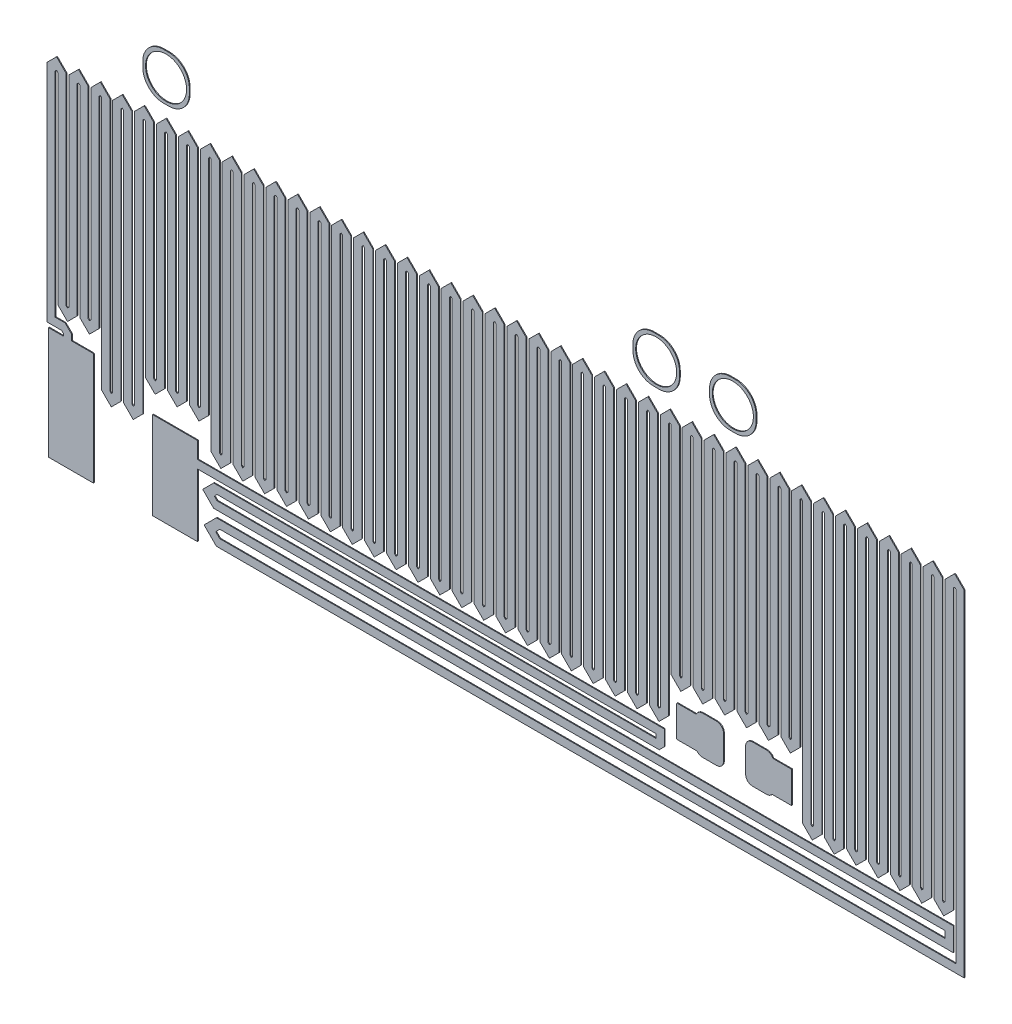
from build123d import *

# Parameters (mm, degrees)
BOSS_EXTRUDE1_DEPTH     = 0.03
BOSS_EXTRUDE1_2_DEPTH   = 0.03
SKETCH4_W               = 1.7
SKETCH4_H               = 1.7
BOSS_EXTRUDE1_3_DEPTH   = 0.03
BOSS_EXTRUDE1_4_DEPTH   = 0.03
BOSS_EXTRUDE1_5_DEPTH   = 0.03
BOSS_EXTRUDE1_6_DEPTH   = 0.03
FILLET1_R               = 0.75
FILLET2_R               = 0.75
FILLET3_R               = 0.75
CUT_EXTRUDE1_DEPTH      = 211.582487992
CUT_EXTRUDE1_DEPTH_BACK = 211.582487992
SKETCH5_R               = 0.75


with BuildPart() as part:
    # Sketch4 → Boss-Extrude1 (new body)
    with BuildSketch(Plane.XY):
        Polygon((165.211, 105.984), (165.158716049, 105.907), (164.464, 105.907), (164.454, 105.903), (164.45, 105.893), (164.45, 104.771), (164.454, 104.761), (164.464, 104.757), (165.192666667, 104.757), (165.211, 104.73), (165.292, 104.676), (165.387, 104.657), (165.912, 104.657), (166.008, 104.676), (166.089, 104.73), (166.143, 104.811), (166.162, 104.907), (166.162, 105.807), (166.143, 105.903), (166.089, 105.984), (166.008, 106.038), (165.912, 106.057), (165.387, 106.057), (165.292, 106.038), align=None)
    extrude(amount=BOSS_EXTRUDE1_DEPTH)


with BuildPart() as body_2:
    # Sketch4 → Boss-Extrude1 2 (new body)
    with BuildSketch(Plane.XY):
        Polygon((166.982, 105.903), (166.963, 105.807), (166.963, 104.907), (166.982, 104.811), (167.036, 104.73), (167.117, 104.676), (167.213, 104.657), (167.738, 104.657), (167.833, 104.676), (167.914, 104.73), (167.932333333, 104.757), (168.636, 104.757), (168.646, 104.761), (168.65, 104.771), (168.65, 105.893), (168.646, 105.903), (168.636, 105.907), (167.966283951, 105.907), (167.914, 105.984), (167.833, 106.038), (167.738, 106.057), (167.213, 106.057), (167.117, 106.038), (167.036, 105.984), align=None)
    extrude(amount=BOSS_EXTRUDE1_2_DEPTH)


with BuildPart() as body_3:
    # Sketch4 → Boss-Extrude1 3 (new body)
    with BuildSketch(Plane.XY):
        with Locations((145.8, 116.357)):
            Rectangle(SKETCH4_W, SKETCH4_H)
    extrude(amount=BOSS_EXTRUDE1_3_DEPTH)

    # Fillet1
    fillet1_edges = [body_3.edges().sort_by_distance(p)[0] for p in [
        (146.65, 115.507, 0.015),
        (144.95, 115.507, 0.015),
        (144.95, 117.207, 0.015),
        (146.65, 117.207, 0.015),
    ]]
    fillet(fillet1_edges, radius=FILLET1_R)


with BuildPart() as body_4:
    # Sketch4 → Boss-Extrude1 4 (new body)
    with BuildSketch(Plane.XY):
        with Locations((163.7, 116.357)):
            Rectangle(SKETCH4_W, SKETCH4_H)
    extrude(amount=BOSS_EXTRUDE1_4_DEPTH)

    # Fillet2
    fillet2_edges = [body_4.edges().sort_by_distance(p)[0] for p in [
        (164.55, 115.507, 0.015),
        (162.85, 115.507, 0.015),
        (164.55, 117.207, 0.015),
        (162.85, 117.207, 0.015),
    ]]
    fillet(fillet2_edges, radius=FILLET2_R)


with BuildPart() as body_5:
    # Sketch4 → Boss-Extrude1 5 (new body)
    with BuildSketch(Plane.XY):
        with Locations((166.5, 116.357)):
            Rectangle(SKETCH4_W, SKETCH4_H)
    extrude(amount=BOSS_EXTRUDE1_5_DEPTH)

    # Fillet3
    fillet3_edges = [body_5.edges().sort_by_distance(p)[0] for p in [
        (165.65, 117.207, 0.015),
        (165.65, 115.507, 0.015),
        (167.35, 115.507, 0.015),
        (167.35, 117.207, 0.015),
    ]]
    fillet(fillet3_edges, radius=FILLET3_R)


with BuildPart() as body_6:
    # Sketch4 → Boss-Extrude1 6 (new body)
    with BuildSketch(Plane.XY):
        Polygon((143.136, 106.307), (142.35, 106.307), (142.35, 106.519132034), (142.112132034, 106.757), (141.75, 106.757), (141.75, 114.544867966), (141.8, 114.594867966), (141.85, 114.544867966), (141.85, 107.194867966), (142.2, 106.844867966), (142.55, 107.194867966), (142.55, 114.544867966), (142.6, 114.594867966), (142.65, 114.544867966), (142.65, 107.194867966), (143, 106.844867966), (143.35, 107.194867966), (143.35, 114.544867966), (143.4, 114.594867966), (143.45, 114.544867966), (143.45, 105.294867966), (143.8, 104.944867966), (144.15, 105.294867966), (144.15, 114.544867966), (144.2, 114.594867966), (144.25, 114.544867966), (144.25, 105.294867966), (144.6, 104.944867966), (144.95, 105.294867966), (144.95, 114.594867966), (145, 114.644867966), (145.05, 114.594867966), (145.05, 106.494867966), (145.4, 106.144867966), (145.75, 106.494867966), (145.75, 114.594867966), (145.8, 114.644867966), (145.85, 114.594867966), (145.85, 106.494867966), (146.2, 106.144867966), (146.55, 106.494867966), (146.55, 114.594867966), (146.6, 114.644867966), (146.65, 114.594867966), (146.65, 106.444867966), (147, 106.094867966), (147.35, 106.444867966), (147.35, 114.594867966), (147.4, 114.644867966), (147.45, 114.594867966), (147.45, 105.344867966), (147.8, 104.994867966), (148.15, 105.344867966), (148.15, 114.594867966), (148.2, 114.644867966), (148.25, 114.594867966), (148.25, 105.344867966), (148.6, 104.994867966), (148.95, 105.344867966), (148.95, 114.594867966), (149, 114.644867966), (149.05, 114.594867966), (149.05, 105.344867966), (149.4, 104.994867966), (149.75, 105.344867966), (149.75, 114.594867966), (149.8, 114.644867966), (149.85, 114.594867966), (149.85, 105.344867966), (150.2, 104.994867966), (150.55, 105.344867966), (150.55, 114.594867966), (150.6, 114.644867966), (150.65, 114.594867966), (150.65, 105.344867966), (151, 104.994867966), (151.35, 105.344867966), (151.35, 114.594867966), (151.4, 114.644867966), (151.45, 114.594867966), (151.45, 105.344867966), (151.8, 104.994867966), (152.15, 105.344867966), (152.15, 114.594867966), (152.2, 114.644867966), (152.25, 114.594867966), (152.25, 105.344867966), (152.6, 104.994867966), (152.95, 105.344867966), (152.95, 114.594867966), (153, 114.644867966), (153.05, 114.594867966), (153.05, 105.344867966), (153.4, 104.994867966), (153.75, 105.344867966), (153.75, 114.594867966), (153.8, 114.644867966), (153.85, 114.594867966), (153.85, 105.344867966), (154.2, 104.994867966), (154.55, 105.344867966), (154.55, 114.594867966), (154.6, 114.644867966), (154.65, 114.594867966), (154.65, 105.344867966), (155, 104.994867966), (155.35, 105.344867966), (155.35, 114.594867966), (155.4, 114.644867966), (155.45, 114.594867966), (155.45, 105.344867966), (155.8, 104.994867966), (156.15, 105.344867966), (156.15, 114.594867966), (156.2, 114.644867966), (156.25, 114.594867966), (156.25, 105.344867966), (156.6, 104.994867966), (156.95, 105.344867966), (156.95, 114.594867966), (157, 114.644867966), (157.05, 114.594867966), (157.05, 105.344867966), (157.4, 104.994867966), (157.75, 105.344867966), (157.75, 114.594867966), (157.8, 114.644867966), (157.85, 114.594867966), (157.85, 105.344867966), (158.2, 104.994867966), (158.55, 105.344867966), (158.55, 114.594867966), (158.6, 114.644867966), (158.65, 114.594867966), (158.65, 105.344867966), (159, 104.994867966), (159.35, 105.344867966), (159.35, 114.594867966), (159.4, 114.644867966), (159.45, 114.594867966), (159.45, 105.344867966), (159.8, 104.994867966), (160.15, 105.344867966), (160.15, 114.594867966), (160.2, 114.644867966), (160.25, 114.594867966), (160.25, 105.344867966), (160.6, 104.994867966), (160.95, 105.344867966), (160.95, 114.594867966), (161, 114.644867966), (161.05, 114.594867966), (161.05, 105.344867966), (161.4, 104.994867966), (161.75, 105.344867966), (161.75, 114.594867966), (161.8, 114.644867966), (161.85, 114.594867966), (161.85, 105.344867966), (162.2, 104.994867966), (162.55, 105.344867966), (162.55, 114.594867966), (162.6, 114.644867966), (162.65, 114.594867966), (162.65, 105.344867966), (163, 104.994867966), (163.35, 105.344867966), (163.35, 114.594867966), (163.4, 114.644867966), (163.45, 114.594867966), (163.45, 105.344867966), (163.8, 104.994867966), (164.15, 105.344867966), (164.15, 114.594867966), (164.2, 114.644867966), (164.25, 114.594867966), (164.25, 106.694867966), (164.6, 106.344867966), (164.95, 106.694867966), (164.95, 114.594867966), (165, 114.644867966), (165.05, 114.594867966), (165.05, 106.694867966), (165.4, 106.344867966), (165.75, 106.694867966), (165.75, 114.594867966), (165.8, 114.644867966), (165.85, 114.594867966), (165.85, 106.744867966), (166.2, 106.394867966), (166.55, 106.744867966), (166.55, 114.594867966), (166.6, 114.644867966), (166.65, 114.594867966), (166.65, 106.744867966), (167, 106.394867966), (167.35, 106.744867966), (167.35, 114.594867966), (167.4, 114.644867966), (167.45, 114.594867966), (167.45, 106.744867966), (167.8, 106.394867966), (168.15, 106.744867966), (168.15, 114.594867966), (168.2, 114.644867966), (168.25, 114.594867966), (168.25, 106.744867966), (168.6, 106.394867966), (168.95, 106.744867966), (168.95, 114.594867966), (169, 114.644867966), (169.05, 114.594867966), (169.05, 104.394867966), (169.4, 104.044867966), (169.75, 104.394867966), (169.75, 114.594867966), (169.8, 114.644867966), (169.85, 114.594867966), (169.85, 104.344867966), (170.2, 103.994867966), (170.55, 104.344867966), (170.55, 114.594867966), (170.6, 114.644867966), (170.65, 114.594867966), (170.65, 104.394867966), (171, 104.044867966), (171.35, 104.394867966), (171.35, 114.594867966), (171.4, 114.644867966), (171.45, 114.594867966), (171.45, 104.394867966), (171.8, 104.044867966), (172.15, 104.394867966), (172.15, 114.594867966), (172.2, 114.644867966), (172.25, 114.594867966), (172.25, 104.394867966), (172.6, 104.044867966), (172.95, 104.394867966), (172.95, 114.594867966), (173, 114.644867966), (173.05, 114.594867966), (173.05, 104.394867966), (173.4, 104.044867966), (173.75, 104.394867966), (173.75, 114.594867966), (173.8, 114.644867966), (173.85, 114.594867966), (173.85, 104.394867966), (174.2, 104.044867966), (174.55, 104.394867966), (174.55, 114.594867966), (174.6, 114.644867966), (174.65, 114.594867966), (174.65, 102.757), (147.762132034, 102.757), (147.612132034, 102.907), (147.762132034, 103.057), (174.55, 103.057), (174.55, 103.907), (147.662132034, 103.907), (147.562132034, 104.007), (147.662132034, 104.107), (163.812132034, 104.107), (164, 104.294867966), (164, 104.857), (146.95, 104.857), (146.95, 105.443), (146.946, 105.453), (146.936, 105.457), (145.314, 105.457), (145.304, 105.453), (145.3, 105.443), (145.3, 102.271), (145.304, 102.261), (145.314, 102.257), (146.936, 102.257), (146.946, 102.261), (146.95, 102.271), (146.95, 104.557), (163.7, 104.557), (163.7, 104.419132034), (163.687867966, 104.407), (147.537867966, 104.407), (147.137867966, 104.007), (147.537867966, 103.607), (174.25, 103.607), (174.25, 103.357), (147.637867966, 103.357), (147.187867966, 102.907), (147.637867966, 102.457), (174.95, 102.457), (174.95, 114.719132034), (174.6, 115.069132034), (174.25, 114.719132034), (174.25, 104.519132034), (174.2, 104.469132034), (174.15, 104.519132034), (174.15, 114.719132034), (173.8, 115.069132034), (173.45, 114.719132034), (173.45, 104.519132034), (173.4, 104.469132034), (173.35, 104.519132034), (173.35, 114.719132034), (173, 115.069132034), (172.65, 114.719132034), (172.65, 104.519132034), (172.6, 104.469132034), (172.55, 104.519132034), (172.55, 114.719132034), (172.2, 115.069132034), (171.85, 114.719132034), (171.85, 104.519132034), (171.8, 104.469132034), (171.75, 104.519132034), (171.75, 114.719132034), (171.4, 115.069132034), (171.05, 114.719132034), (171.05, 104.519132034), (171, 104.469132034), (170.95, 104.519132034), (170.95, 114.719132034), (170.6, 115.069132034), (170.25, 114.719132034), (170.25, 104.469132034), (170.2, 104.419132034), (170.15, 104.469132034), (170.15, 114.719132034), (169.8, 115.069132034), (169.45, 114.719132034), (169.45, 104.519132034), (169.4, 104.469132034), (169.35, 104.519132034), (169.35, 114.719132034), (169, 115.069132034), (168.65, 114.719132034), (168.65, 106.869132034), (168.6, 106.819132034), (168.55, 106.869132034), (168.55, 114.719132034), (168.2, 115.069132034), (167.85, 114.719132034), (167.85, 106.869132034), (167.8, 106.819132034), (167.75, 106.869132034), (167.75, 114.719132034), (167.4, 115.069132034), (167.05, 114.719132034), (167.05, 106.869132034), (167, 106.819132034), (166.95, 106.869132034), (166.95, 114.719132034), (166.6, 115.069132034), (166.25, 114.719132034), (166.25, 106.869132034), (166.2, 106.819132034), (166.15, 106.869132034), (166.15, 114.719132034), (165.8, 115.069132034), (165.45, 114.719132034), (165.45, 106.819132034), (165.4, 106.769132034), (165.35, 106.819132034), (165.35, 114.719132034), (165, 115.069132034), (164.65, 114.719132034), (164.65, 106.819132034), (164.6, 106.769132034), (164.55, 106.819132034), (164.55, 114.719132034), (164.2, 115.069132034), (163.85, 114.719132034), (163.85, 105.469132034), (163.8, 105.419132034), (163.75, 105.469132034), (163.75, 114.719132034), (163.4, 115.069132034), (163.05, 114.719132034), (163.05, 105.469132034), (163, 105.419132034), (162.95, 105.469132034), (162.95, 114.719132034), (162.6, 115.069132034), (162.25, 114.719132034), (162.25, 105.469132034), (162.2, 105.419132034), (162.15, 105.469132034), (162.15, 114.719132034), (161.8, 115.069132034), (161.45, 114.719132034), (161.45, 105.469132034), (161.4, 105.419132034), (161.35, 105.469132034), (161.35, 114.719132034), (161, 115.069132034), (160.65, 114.719132034), (160.65, 105.469132034), (160.6, 105.419132034), (160.55, 105.469132034), (160.55, 114.719132034), (160.2, 115.069132034), (159.85, 114.719132034), (159.85, 105.469132034), (159.8, 105.419132034), (159.75, 105.469132034), (159.75, 114.719132034), (159.4, 115.069132034), (159.05, 114.719132034), (159.05, 105.469132034), (159, 105.419132034), (158.95, 105.469132034), (158.95, 114.719132034), (158.6, 115.069132034), (158.25, 114.719132034), (158.25, 105.469132034), (158.2, 105.419132034), (158.15, 105.469132034), (158.15, 114.719132034), (157.8, 115.069132034), (157.45, 114.719132034), (157.45, 105.469132034), (157.4, 105.419132034), (157.35, 105.469132034), (157.35, 114.719132034), (157, 115.069132034), (156.65, 114.719132034), (156.65, 105.469132034), (156.6, 105.419132034), (156.55, 105.469132034), (156.55, 114.719132034), (156.2, 115.069132034), (155.85, 114.719132034), (155.85, 105.469132034), (155.8, 105.419132034), (155.75, 105.469132034), (155.75, 114.719132034), (155.4, 115.069132034), (155.05, 114.719132034), (155.05, 105.469132034), (155, 105.419132034), (154.95, 105.469132034), (154.95, 114.719132034), (154.6, 115.069132034), (154.25, 114.719132034), (154.25, 105.469132034), (154.2, 105.419132034), (154.15, 105.469132034), (154.15, 114.719132034), (153.8, 115.069132034), (153.45, 114.719132034), (153.45, 105.469132034), (153.4, 105.419132034), (153.35, 105.469132034), (153.35, 114.719132034), (153, 115.069132034), (152.65, 114.719132034), (152.65, 105.469132034), (152.6, 105.419132034), (152.55, 105.469132034), (152.55, 114.719132034), (152.2, 115.069132034), (151.85, 114.719132034), (151.85, 105.469132034), (151.8, 105.419132034), (151.75, 105.469132034), (151.75, 114.719132034), (151.4, 115.069132034), (151.05, 114.719132034), (151.05, 105.469132034), (151, 105.419132034), (150.95, 105.469132034), (150.95, 114.719132034), (150.6, 115.069132034), (150.25, 114.719132034), (150.25, 105.469132034), (150.2, 105.419132034), (150.15, 105.469132034), (150.15, 114.719132034), (149.8, 115.069132034), (149.45, 114.719132034), (149.45, 105.469132034), (149.4, 105.419132034), (149.35, 105.469132034), (149.35, 114.719132034), (149, 115.069132034), (148.65, 114.719132034), (148.65, 105.469132034), (148.6, 105.419132034), (148.55, 105.469132034), (148.55, 114.719132034), (148.2, 115.069132034), (147.85, 114.719132034), (147.85, 105.469132034), (147.8, 105.419132034), (147.75, 105.469132034), (147.75, 114.719132034), (147.4, 115.069132034), (147.05, 114.719132034), (147.05, 106.569132034), (147, 106.519132034), (146.95, 106.569132034), (146.95, 114.719132034), (146.6, 115.069132034), (146.25, 114.719132034), (146.25, 106.619132034), (146.2, 106.569132034), (146.15, 106.619132034), (146.15, 114.719132034), (145.8, 115.069132034), (145.45, 114.719132034), (145.45, 106.619132034), (145.4, 106.569132034), (145.35, 106.619132034), (145.35, 114.719132034), (145, 115.069132034), (144.65, 114.719132034), (144.65, 105.419132034), (144.6, 105.369132034), (144.55, 105.419132034), (144.55, 114.669132034), (144.2, 115.019132034), (143.85, 114.669132034), (143.85, 105.419132034), (143.8, 105.369132034), (143.75, 105.419132034), (143.75, 114.669132034), (143.4, 115.019132034), (143.05, 114.669132034), (143.05, 107.319132034), (143, 107.269132034), (142.95, 107.319132034), (142.95, 114.669132034), (142.6, 115.019132034), (142.25, 114.669132034), (142.25, 107.319132034), (142.2, 107.269132034), (142.15, 107.319132034), (142.15, 114.669132034), (141.8, 115.019132034), (141.45, 114.669132034), (141.45, 106.457), (141.987867966, 106.457), (142.05, 106.394867966), (142.05, 106.307), (141.514, 106.307), (141.504, 106.303), (141.5, 106.293), (141.5, 102.222), (141.504, 102.212), (141.514, 102.208), (143.136, 102.208), (143.146, 102.212), (143.15, 102.222), (143.15, 106.293), (143.146, 106.303), align=None)
    extrude(amount=BOSS_EXTRUDE1_6_DEPTH)


with BuildPart() as cut_extrude1_tool:
    # Sketch5 → Cut-Extrude1 (new, two sides: drawn at the far end of the back side and taken through both)
    with BuildSketch(Plane.XY.offset(0.03).offset(-CUT_EXTRUDE1_DEPTH_BACK)):
        with Locations((145.8, 116.357)):
            Circle(SKETCH5_R)
        with Locations((163.7, 116.357)):
            Circle(SKETCH5_R)
        with Locations((166.5, 116.357)):
            Circle(SKETCH5_R)
    extrude(amount=CUT_EXTRUDE1_DEPTH + CUT_EXTRUDE1_DEPTH_BACK)


with BuildPart() as body_3_1:
    add(body_3.part)

    # Cut-Extrude1: cut by cut_extrude1_tool
    add(cut_extrude1_tool.part, mode=Mode.SUBTRACT)


with BuildPart() as body_4_1:
    add(body_4.part)

    # Cut-Extrude1: cut by cut_extrude1_tool
    add(cut_extrude1_tool.part, mode=Mode.SUBTRACT)


with BuildPart() as body_5_1:
    add(body_5.part)

    # Cut-Extrude1: cut by cut_extrude1_tool
    add(cut_extrude1_tool.part, mode=Mode.SUBTRACT)


solid = Compound([part.part, body_2.part, body_6.part, body_3_1.part, body_4_1.part, body_5_1.part])
